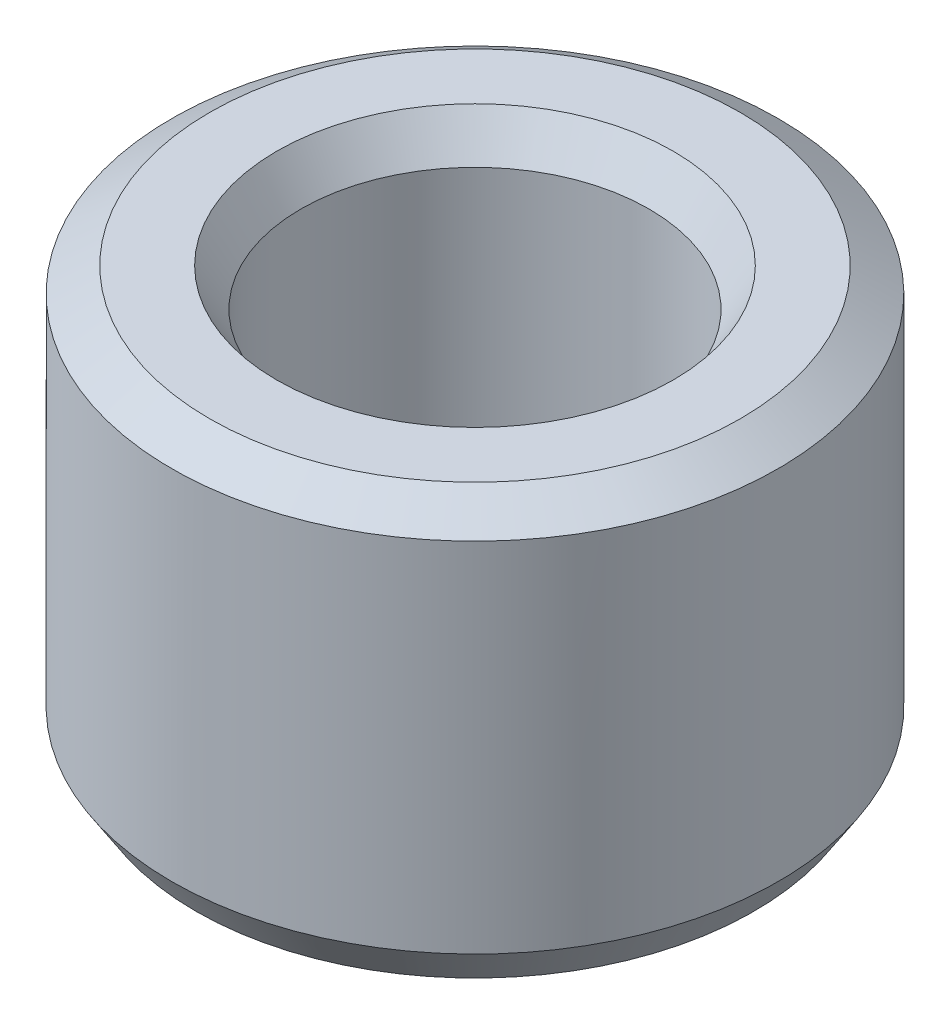
from build123d import *
from OCP.BRepFilletAPI import BRepFilletAPI_MakeChamfer

# Parameters (mm, degrees)
SKETCH1_R           = 37.5
BOSS_EXTRUDE1_DEPTH = 51.907252351
SKETCH2_R           = 21.517397886
CUT_EXTRUDE1_DEPTH  = 75.208239749
CHAMFER1_SIZE       = 2.998359242
CHAMFER1_SIZE2      = 4.687826308


with BuildPart() as part:
    # Sketch1 → Boss-Extrude1 (new body)
    with BuildSketch(Plane(origin=(0, 0, 0), x_dir=(1, 0, 0), z_dir=(0, 1, 0))):
        Circle(SKETCH1_R)
    extrude(amount=BOSS_EXTRUDE1_DEPTH)

    # Sketch2 → Cut-Extrude1 (cut, through all)
    with BuildSketch(Plane(origin=(0, 0, 0), x_dir=(1, 0, 0), z_dir=(0, 1, 0))):
        Circle(SKETCH2_R)
    extrude(amount=CUT_EXTRUDE1_DEPTH, mode=Mode.SUBTRACT)

    # Chamfer1: one chamfer whose edges measure the first distance from different faces: ONE call of the kernel's chamfer builder (chamfer() names one face for all edges)
    chamfer1_edges_1 = [part.edges().sort_by_distance(p)[0] for p in [
        (-21.517397886, 51.907252351, 0),
    ]]
    chamfer1_side_1 = [part.faces().sort_by_distance(p)[0] for p in [
        (-36.439339828, 51.907252351, 0),
    ]]
    chamfer1_edges_2 = [part.edges().sort_by_distance(p)[0] for p in [
        (-21.517397886, 0, 0),
    ]]
    chamfer1_side_2 = [part.faces().sort_by_distance(p)[0] for p in [
        (-21.517397886, 25.953626176, 0),
    ]]
    chamfer1_edges_3 = [part.edges().sort_by_distance(p)[0] for p in [
        (-37.5, 0, 0),
    ]]
    chamfer1_side_3 = [part.faces().sort_by_distance(p)[0] for p in [
        (-36.439339828, 0, 0),
    ]]
    chamfer1_edges_4 = [part.edges().sort_by_distance(p)[0] for p in [
        (-37.5, 51.907252351, 0),
    ]]
    chamfer1_side_4 = [part.faces().sort_by_distance(p)[0] for p in [
        (-37.5, 25.953626176, 0),
    ]]
    chamfer1 = BRepFilletAPI_MakeChamfer(part.part.solid().wrapped)
    for e in chamfer1_edges_1:
        chamfer1.Add(CHAMFER1_SIZE, CHAMFER1_SIZE2, e.wrapped, chamfer1_side_1[0].wrapped)  # the first distance lies on this face
    for e in chamfer1_edges_2:
        chamfer1.Add(CHAMFER1_SIZE, CHAMFER1_SIZE2, e.wrapped, chamfer1_side_2[0].wrapped)  # the first distance lies on this face
    for e in chamfer1_edges_3:
        chamfer1.Add(CHAMFER1_SIZE, CHAMFER1_SIZE2, e.wrapped, chamfer1_side_3[0].wrapped)  # the first distance lies on this face
    for e in chamfer1_edges_4:
        chamfer1.Add(CHAMFER1_SIZE, CHAMFER1_SIZE2, e.wrapped, chamfer1_side_4[0].wrapped)  # the first distance lies on this face
    add(Compound.cast(chamfer1.Shape()), mode=Mode.REPLACE)


solid = part.part
